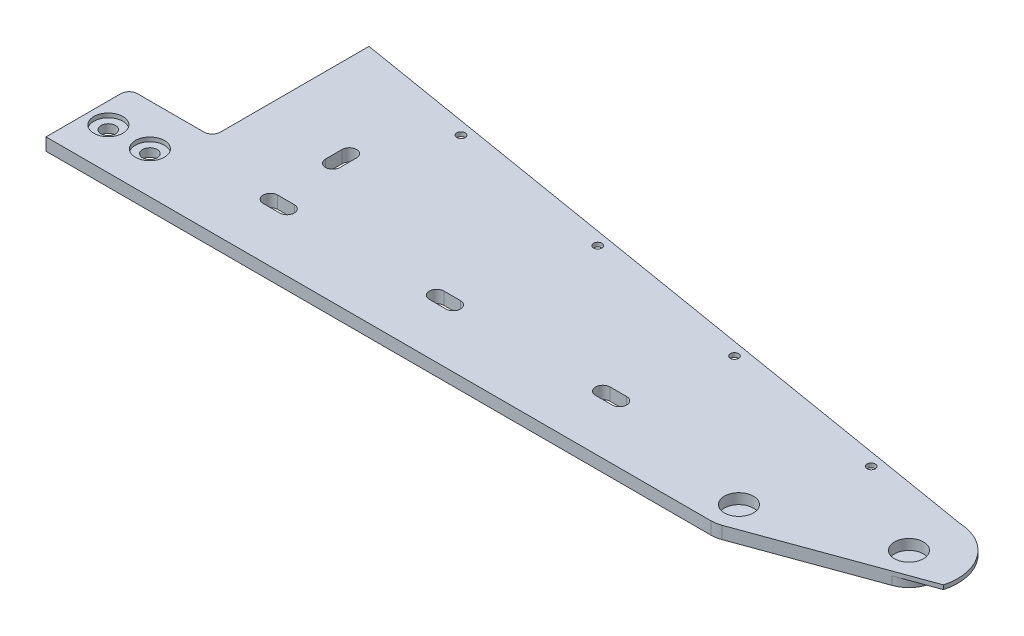
from build123d import *

# Parameters (mm, degrees)
SKETCH_1_W           = 35
SKETCH_1_H           = 55
EXTRUDE_1_DEPTH      = 1
EXTRUDE_2_DEPTH      = 3
SKETCH_3_R           = 5
CUT_EXTRUDE_1_DEPTH  = 169.569903897
SKETCH_4_R           = 4
CUT_EXTRUDE_2_DEPTH  = 2
SKETCH_5_R           = 2
CUT_EXTRUDE_3_DEPTH  = 2
EXTRUDE_START        = 7
EXTRUDE_3_DEPTH      = 7
CUT_EXTRUDE_START    = -1.5
SKETCH_9_W           = 10
SKETCH_9_H           = 26
CUT_EXTRUDE_4_DEPTH  = 168.318874833
SKETCH_10_R          = 1.5
CUT_EXTRUDE_5_DEPTH  = 194.595583627
EXTRUDE_4_DEPTH      = 3
SKETCH_13_W          = 334.012533363
SKETCH_13_H          = 161.456209481
CUT_EXTRUDE_6_DEPTH  = 10
CUT_EXTRUDE_START_2  = -0.5
SKETCH_14_R          = 3.5
CUT_EXTRUDE_7_DEPTH  = 179.354165453
SKETCH_15_R          = 5
CUT_EXTRUDE_8_DEPTH  = 179.854165453
EXTRUDE_START_2      = -3
EXTRUDE_5_DEPTH      = 16
EXTRUDE_7_DEPTH      = 7
SKETCH_24_W          = 10
SKETCH_24_H          = 26
CUT_EXTRUDE_11_DEPTH = 180.209193181
SKETCH_25_R          = 1.5
CUT_EXTRUDE_12_DEPTH = 176.793913433
THREAD_2_PITCH       = 0.6
CUT_EXTRUDE_13_DEPTH = 181.709193232
EXTRUDE_START_3      = 2
SKETCH_27_R          = 5
EXTRUDE_8_DEPTH      = 2
CUT_EXTRUDE_START_3  = -2
SKETCH_28_W          = 25
SKETCH_28_H          = 47.640496167
CUT_EXTRUDE_14_DEPTH = 182.247184378
SKETCH_29_R          = 7.5
CUT_EXTRUDE_15_DEPTH = 4
CUT_EXTRUDE_16_DEPTH = 10
SKETCH_32_R          = 1.896812978
CUT_EXTRUDE_17_DEPTH = 10
CUT_EXTRUDE_START_4  = -19
CUT_EXTRUDE_18_DEPTH = 2
CUT_EXTRUDE_19_DEPTH = 180.762490825
CUT_EXTRUDE_20_DEPTH = 176.782687167
CUT_EXTRUDE_21_DEPTH = 175.343166372
SKETCH_37_R          = 1
CUT_EXTRUDE_22_DEPTH = 175.199743974
EXTRUDE_START_4      = -1
SKETCH_39_R          = 5
EXTRUDE_9_DEPTH      = 1
SKETCH_40_W          = 2.395962652
SKETCH_40_H          = 5.687033247
CUT_EXTRUDE_23_DEPTH = 192.518571686
SKETCH_41_W          = 88.49347393
SKETCH_41_H          = 24.829104196
CUT_EXTRUDE_24_DEPTH = 192.518571686
SKETCH_42_W          = 20
SKETCH_42_H          = 3
EXTRUDE_10_DEPTH     = 20
SKETCH_43_R          = 1.75
CUT_EXTRUDE_25_DEPTH = 20
SKETCH_45_R          = 3.5
CUT_EXTRUDE_26_DEPTH = 1
FILLET_1_R           = 2


with BuildPart() as part:
    # 草图1 → 凸台-拉伸1 (new body)
    with BuildSketch(Plane(origin=(0, 0, 0), x_dir=(1, 0, 0), z_dir=(0, 1, 0))):
        Rectangle(SKETCH_1_W, SKETCH_1_H)
    extrude(amount=EXTRUDE_1_DEPTH)

    # Sketch 2 → 凸台-拉伸2 (add)
    with BuildSketch(Plane(origin=(0, 1, 0), x_dir=(1, 0, 0), z_dir=(0, 1, 0))):
        with BuildLine():
            Line((106.75, -2.25), (106.75, 2.25))
            Line((106.75, 2.25), (121.75, 2.25))
            ThreePointArc((121.75, 2.25), (122.922125199, 2.352547667), (124.058635967, 2.65707481))
            Line((124.058635967, 2.65707481), (154.058635967, 13.576181838))
            ThreePointArc((154.058635967, 13.576181838), (158.397452333, 21.091232227), (151.75, 26.669107028))
            Line((151.75, 26.669107028), (-31.447415548, 57.101298968))
            ThreePointArc((-31.447415548, 57.101298968), (-37.800418235, 56.264673928), (-42.609265279, 52.029632639))
            Line((-42.609265279, 52.029632639), (-60.161792173, 23.605896086))
            ThreePointArc((-60.161792173, 23.605896086), (-61.717833724, 20.073278016), (-62.25, 16.25))
            Line((-62.25, 16.25), (-62.25, -16.25))
            ThreePointArc((-62.25, -16.25), (-61.717833724, -20.073278016), (-60.161792173, -23.605896086))
            Line((-60.161792173, -23.605896086), (-42.609265279, -52.029632639))
            ThreePointArc((-42.609265279, -52.029632639), (-37.800418235, -56.264673928), (-31.447415548, -57.101298968))
            Line((-31.447415548, -57.101298968), (151.75, -26.669107028))
            ThreePointArc((151.75, -26.669107028), (158.397452333, -21.091232227), (154.058635967, -13.576181838))
            Line((154.058635967, -13.576181838), (124.058635967, -2.65707481))
            ThreePointArc((124.058635967, -2.65707481), (122.922125199, -2.352547667), (121.75, -2.25))
            Line((121.75, -2.25), (106.75, -2.25))
        make_face()
    extrude(amount=EXTRUDE_2_DEPTH)

    # 草图3 → 切除-拉伸1 (cut, through all)
    with BuildSketch(Plane(origin=(0, 4, 0), x_dir=(1, 0, 0), z_dir=(0, 1, 0))):
        with Locations(Location((-48.25, 16.25, 0), (0, 0, 270))):
            Circle(SKETCH_3_R)
        with Locations(Location((-48.25, -16.25, 0), (0, 0, 270))):
            Circle(SKETCH_3_R)
    extrude(amount=-CUT_EXTRUDE_1_DEPTH, mode=Mode.SUBTRACT)

    # 草图4 → 切除-拉伸2 (cut)
    with BuildSketch(Plane(origin=(0, 4, 0), x_dir=(1, 0, 0), z_dir=(0, 1, 0))):
        with Locations(Location((-33.25, 46.25, 0), (0, 0, 270))):
            Circle(SKETCH_4_R)
        with Locations(Location((-33.25, -46.25, 0), (0, 0, 270))):
            Circle(SKETCH_4_R)
    extrude(amount=-CUT_EXTRUDE_2_DEPTH, mode=Mode.SUBTRACT)

    # 草图5 → 切除-拉伸3 (cut)
    with BuildSketch(Plane(origin=(0, 4, 0), x_dir=(1, 0, 0), z_dir=(0, 1, 0))):
        with Locations(Location((121.75, 9, 0), (0, 0, 270))):
            Circle(SKETCH_5_R)
        with Locations(Location((121.75, -9, 0), (0, 0, 270))):
            Circle(SKETCH_5_R)
        with Locations(Location((151.75, 19.919107028, 0), (0, 0, 270))):
            Circle(SKETCH_5_R)
        with Locations(Location((151.75, -19.919107028, 0), (0, 0, 270))):
            Circle(SKETCH_5_R)
    extrude(amount=-CUT_EXTRUDE_3_DEPTH, mode=Mode.SUBTRACT)

    # 草图8 → 凸台-拉伸3 (add)
    with BuildSketch(Plane.XZ.offset(-1).offset(EXTRUDE_START)):
        with BuildLine():
            Line((-26.75, -26.25), (-39.75, -26.25))
            Line((-39.75, -26.25), (-39.75, -55.124119675))
            ThreePointArc((-39.75, -55.124119675), (-35.798281322, -56.950759894), (-31.447415548, -57.101298968))
            Line((-31.447415548, -57.101298968), (-26.75, -56.320978726))
            Line((-26.75, -56.320978726), (-26.75, -26.25))
        make_face()
    extrude_3 = extrude(amount=-EXTRUDE_3_DEPTH)

    # 镜向1: 凸台-拉伸3 across plane
    add(extrude_3.mirror(Plane.XY))

    # 草图9 → 切除-拉伸4 (cut, through all)
    with BuildSketch(Plane.XZ.offset(6).offset(CUT_EXTRUDE_START)):
        with Locations((-33.25, -40.75)):
            Rectangle(SKETCH_9_W, SKETCH_9_H)
    cut_extrude_4 = extrude(amount=-CUT_EXTRUDE_4_DEPTH, mode=Mode.SUBTRACT)

    # 镜向2: 切除-拉伸4 across plane
    add(cut_extrude_4.mirror(Plane.XY), mode=Mode.SUBTRACT)

    # 草图10 → 切除-拉伸5 (cut, through all)
    with BuildSketch(Plane.XY.offset(-53.75)):
        with Locations((-33.25, -1.5)):
            Circle(SKETCH_10_R)
    cut_extrude_5 = extrude(amount=-CUT_EXTRUDE_5_DEPTH, mode=Mode.SUBTRACT)

    # 镜向3: 切除-拉伸5 across plane
    add(cut_extrude_5.mirror(Plane.XY), mode=Mode.SUBTRACT)

    # 草图12 → 凸台-拉伸4 (add)
    with BuildSketch(Plane(origin=(0, 4, 0), x_dir=(1, 0, 0), z_dir=(0, 1, 0))):
        with BuildLine():
            Line((152.536154407, 34.648141662), (-30.136445037, 64.993152763))
            ThreePointArc((-30.136445037, 64.993152763), (-32.296727103, 65.226071005), (-34.469475839, 65.210824842))
            Line((-34.469475839, 65.210824842), (-60.161792173, 23.605896086))
            ThreePointArc((-60.161792173, 23.605896086), (-61.717833724, 20.073278016), (-62.25, 16.25))
            Line((-62.25, 16.25), (-62.25, 2.25))
            Line((-62.25, 2.25), (121.75, 2.25))
            ThreePointArc((121.75, 2.25), (122.922125199, 2.352547667), (124.058635967, 2.65707481))
            Line((124.058635967, 2.65707481), (166.382589153, 18.061733966))
            ThreePointArc((166.382589153, 18.061733966), (163.073058037, 29.371665237), (152.536154407, 34.648141662))
        make_face()
    extrude(amount=EXTRUDE_4_DEPTH)

    # 草图13 → 切除-拉伸6 (cut)
    with BuildSketch(Plane.XZ.offset(-4)):
        with Locations((47.836319436, 6.16656882)):
            Rectangle(SKETCH_13_W, SKETCH_13_H)
    extrude(amount=CUT_EXTRUDE_6_DEPTH, mode=Mode.SUBTRACT)

    # 草图14 → 切除-拉伸7 (cut, through all)
    with BuildSketch(Plane.XZ.offset(-4).offset(CUT_EXTRUDE_START_2)):
        with Locations(Location((151.75, -19.919107028, 0), (0, 0, 270))):
            Circle(SKETCH_14_R)
        with Locations(Location((121.75, -9, 0), (0, 0, 270))):
            Circle(SKETCH_14_R)
    extrude(amount=-CUT_EXTRUDE_7_DEPTH, mode=Mode.SUBTRACT)

    # 草图15 → 切除-拉伸8 (cut, through all)
    with BuildSketch(Plane.XZ.offset(-4)):
        with Locations(Location((-48.25, -16.25, 0), (0, 0, 270))):
            Circle(SKETCH_15_R)
    extrude(amount=-CUT_EXTRUDE_8_DEPTH, mode=Mode.SUBTRACT)

    # 草图17 → 凸台-拉伸5 (add)
    with BuildSketch(Plane.XZ.offset(-4).offset(EXTRUDE_START_2)):
        with BuildLine():
            Line((-30.628058978, -62.03370759), (152.218782473, -31.659751942))
            ThreePointArc((152.218782473, -31.659751942), (161.216553887, -26.879484712), (163.096310198, -16.865626245))
            Line((163.096310198, -16.865626245), (166.382589153, -18.061733966))
            ThreePointArc((166.382589153, -18.061733966), (163.073058037, -29.371665237), (152.536154407, -34.648141662))
            Line((152.536154407, -34.648141662), (-30.136445037, -64.993152763))
            ThreePointArc((-30.136445037, -64.993152763), (-32.296727103, -65.226071005), (-34.469475839, -65.210824842))
            Line((-34.469475839, -65.210824842), (-36.504423199, -61.915526791))
            ThreePointArc((-36.504423199, -61.915526791), (-33.571714316, -62.246765295), (-30.628058978, -62.03370759))
        make_face()
    extrude(amount=-EXTRUDE_5_DEPTH)

    # 草图23 → 凸台-拉伸7 (add)
    with BuildSketch(Plane.XZ.offset(-4).offset(EXTRUDE_START)):
        with BuildLine():
            Line((-39.75, -56.65979236), (-39.75, -26.25))
            Line((-39.75, -26.25), (-26.75, -26.25))
            Line((-26.75, -26.25), (-26.75, -64.430606916))
            Line((-26.75, -64.430606916), (-30.136445037, -64.993152763))
            ThreePointArc((-30.136445037, -64.993152763), (-32.296727103, -65.226071005), (-34.469475839, -65.210824842))
            Line((-34.469475839, -65.210824842), (-39.75, -56.65979236))
        make_face()
    extrude(amount=-EXTRUDE_7_DEPTH)

    # 草图24 → 切除-拉伸11 (cut, through all)
    with BuildSketch(Plane.XZ.offset(3).offset(CUT_EXTRUDE_START)):
        with Locations((-33.25, -40.75)):
            Rectangle(SKETCH_24_W, SKETCH_24_H)
    extrude(amount=-CUT_EXTRUDE_11_DEPTH, mode=Mode.SUBTRACT)

    # 草图25 → 切除-拉伸12 (cut, through all)
    with BuildSketch(Plane.XY.offset(-53.75)):
        with Locations((-33.25, 1.5)):
            Circle(SKETCH_25_R)
    extrude(amount=-CUT_EXTRUDE_12_DEPTH, mode=Mode.SUBTRACT)

    # 螺纹线2: the profile of Sketch 2 2 profile screwed along a right-hand helix of 25 turns, 6 arcs to a turn; built about Z, then put on its axis
    thread_2_z = Axis((0, 0, 0), (0, 0, 1))
    thread_2_corners = [(1.4997, 0, -0.000173205), (1.824759525, 0, 0.187499999), (1.824759525, 0, 0.262499999), (1.4997, 0, 0.450173203)]
    with BuildLine(mode=Mode.PRIVATE) as thread_2_profile:
        Line(thread_2_corners[0], thread_2_corners[1])
        Line(thread_2_corners[1], thread_2_corners[2])
        Line(thread_2_corners[2], thread_2_corners[3])
        Line(thread_2_corners[3], thread_2_corners[0])
    thread_2_cap = Face(thread_2_profile.wire())
    thread_2_turn_angles = [0, 30, 60, 90, 120, 150, 180, 210, 240, 270, 300, 330, 360]
    thread_2_turn_weights = [1, 0.8660254037844387, 1, 0.8660254037844387, 1, 0.8660254037844387, 1, 0.8660254037844387, 1, 0.8660254037844387, 1, 0.8660254037844387, 1]
    thread_2_turn_rails = [Edge.make_bspline([Vector(p[0], p[1], 0).rotate(thread_2_z, thread_2_turn_angles[k]) / thread_2_turn_weights[k] + Vector(0, 0, p[2] + THREAD_2_PITCH * thread_2_turn_angles[k] / 360) for k in range(13)], [0, 0, 0, 1, 1, 2, 2, 3, 3, 4, 4, 5, 5, 6, 6, 6], 2, thread_2_turn_weights) for p in thread_2_corners]
    thread_2_turn_sides = [Face.make_surface_from_curves(thread_2_turn_rails[p[0]], thread_2_turn_rails[p[1]]) for p in [(0, 1), (1, 2), (2, 3), (3, 0)]]
    thread_2 = Plane(origin=(-33.25, 1.5, -53.75), x_dir=(-1, 0, 0), z_dir=(0, 0, -1)) * Solid(Shell([*[p.moved(Location((0, 0, THREAD_2_PITCH * i))) for i in range(25) for p in thread_2_turn_sides], thread_2_cap, thread_2_cap.rotate(thread_2_z, 9000).moved(Location((0, 0, THREAD_2_PITCH * 9000 / 360)))]))
    add(thread_2, mode=Mode.SUBTRACT)

    # 草图26 → 切除-拉伸13 (cut, through all)
    with BuildSketch(Plane.XZ.offset(3)):
        with BuildLine():
            Line((-26.75, -64.430606916), (-26.75, -26.25))
            Line((-26.75, -26.25), (-39.75, -26.25))
            Line((-39.75, -26.25), (-39.75, -56.65979236))
            Line((-39.75, -56.65979236), (-34.469475839, -65.210824842))
            ThreePointArc((-34.469475839, -65.210824842), (-32.296727103, -65.226071005), (-30.136445037, -64.993152763))
            Line((-30.136445037, -64.993152763), (-26.75, -64.430606916))
        make_face()
    extrude(amount=-CUT_EXTRUDE_13_DEPTH, mode=Mode.SUBTRACT)

    # 草图27 → 凸台-拉伸8 (add)
    with BuildSketch(Plane.XZ.offset(-4).offset(EXTRUDE_START_3)):
        with BuildLine():
            Line((-39.75, -56.65979236), (-39.75, -26.25))
            Line((-39.75, -26.25), (-26.75, -26.25))
            Line((-26.75, -26.25), (-26.75, -64.430606916))
            Line((-26.75, -64.430606916), (-18.25, -63.018613025))
            Line((-18.25, -63.018613025), (-18.25, -2.25))
            Line((-18.25, -2.25), (-62.25, -2.25))
            Line((-62.25, -2.25), (-62.25, -16.25))
            ThreePointArc((-62.25, -16.25), (-61.717833724, -20.073278016), (-60.161792173, -23.605896086))
            Line((-60.161792173, -23.605896086), (-39.75, -56.65979236))
        make_face()
        with Locations(Location((-48.25, -16.25, 0), (0, 0, 270))):
            Circle(SKETCH_27_R, mode=Mode.SUBTRACT)
    extrude(amount=-EXTRUDE_8_DEPTH)

    # 草图28 → 切除-拉伸14 (cut, through all)
    with BuildSketch(Plane(origin=(0, 7, 0), x_dir=(1, 0, 0), z_dir=(0, 1, 0)).offset(CUT_EXTRUDE_START_3)):
        with Locations((-33.25, 50.070248084)):
            Rectangle(SKETCH_28_W, SKETCH_28_H)
    extrude(amount=CUT_EXTRUDE_14_DEPTH, mode=Mode.SUBTRACT)

    # 草图29 → 切除-拉伸15 (cut)
    with BuildSketch(Plane(origin=(0, 7, 0), x_dir=(1, 0, 0), z_dir=(0, 1, 0))):
        with Locations(Location((-48.25, 16.25, 0), (0, 0, 270))):
            Circle(SKETCH_29_R)
    extrude(amount=-CUT_EXTRUDE_15_DEPTH, mode=Mode.SUBTRACT)

    # 草图31 → 切除-拉伸16 (cut)
    with BuildSketch(Plane.XZ.offset(-4)):
        with BuildLine():
            Line((7.5, -16.25), (0, -16.25))
            ThreePointArc((0, -16.25), (0.512563133, -17.487436867), (1.75, -18))
            Line((1.75, -18), (5.75, -18))
            ThreePointArc((5.75, -18), (6.987436867, -17.487436867), (7.5, -16.25))
        make_face()
        with BuildLine():
            ThreePointArc((1.75, -14.5), (0.512563133, -15.012563133), (0, -16.25))
            Line((0, -16.25), (7.5, -16.25))
            ThreePointArc((7.5, -16.25), (6.987436867, -15.012563133), (5.75, -14.5))
            Line((5.75, -14.5), (1.75, -14.5))
        make_face()
        with BuildLine():
            Line((47.5, -16.25), (40, -16.25))
            ThreePointArc((40, -16.25), (40.512563133, -17.487436867), (41.75, -18))
            Line((41.75, -18), (45.75, -18))
            ThreePointArc((45.75, -18), (46.987436867, -17.487436867), (47.5, -16.25))
        make_face()
        with BuildLine():
            ThreePointArc((41.75, -14.5), (40.512563133, -15.012563133), (40, -16.25))
            Line((40, -16.25), (47.5, -16.25))
            ThreePointArc((47.5, -16.25), (46.987436867, -15.012563133), (45.75, -14.5))
            Line((45.75, -14.5), (41.75, -14.5))
        make_face()
        with BuildLine():
            ThreePointArc((81.75, -14.5), (80.512563133, -15.012563133), (80, -16.25))
            Line((80, -16.25), (87.5, -16.25))
            ThreePointArc((87.5, -16.25), (86.987436867, -15.012563133), (85.75, -14.5))
            Line((85.75, -14.5), (81.75, -14.5))
        make_face()
        with BuildLine():
            Line((87.5, -16.25), (80, -16.25))
            ThreePointArc((80, -16.25), (80.512563133, -17.487436867), (81.75, -18))
            Line((81.75, -18), (85.75, -18))
            ThreePointArc((85.75, -18), (86.987436867, -17.487436867), (87.5, -16.25))
        make_face()
        with BuildLine():
            Line((0, -31.25), (0, -35.25))
            ThreePointArc((0, -35.25), (1.75, -37), (3.5, -35.25))
            Line((3.5, -35.25), (3.5, -31.25))
            ThreePointArc((3.5, -31.25), (1.75, -29.5), (0, -31.25))
        make_face()
    extrude(amount=-CUT_EXTRUDE_16_DEPTH, mode=Mode.SUBTRACT)

    # 草图32 → 切除-拉伸17 (cut)
    with BuildSketch(Plane(origin=(0, 5, 0), x_dir=(1, 0, 0), z_dir=(0, 1, 0))):
        with Locations(Location((-42.75, 41.25, 0), (0, 0, 270))):
            Circle(SKETCH_32_R)
        with Locations(Location((-42.75, 31.25, 0), (0, 0, 270))):
            Circle(SKETCH_32_R)
        with Locations(Location((-23.607466011, 41.25, 0), (0, 0, 270))):
            Circle(SKETCH_32_R)
        with Locations(Location((-23.607466011, 31.25, 0), (0, 0, 270))):
            Circle(SKETCH_32_R)
    extrude(amount=-CUT_EXTRUDE_17_DEPTH, mode=Mode.SUBTRACT)

    # 草图33 → 切除-拉伸18 (cut)
    with BuildSketch(Plane(origin=(0, 23, 0), x_dir=(1, 0, 0), z_dir=(0, 1, 0)).offset(CUT_EXTRUDE_START_4)):
        with BuildLine():
            Line((-26.75, 56.320978726), (151.75, 26.669107028))
            ThreePointArc((151.75, 26.669107028), (158.397452333, 21.091232227), (154.058635967, 13.576181838))
            Line((154.058635967, 13.576181838), (163.096310198, 16.865626245))
            Line((163.096310198, 16.865626245), (166.382589153, 18.061733966))
            ThreePointArc((166.382589153, 18.061733966), (163.073058037, 29.371665237), (152.536154407, 34.648141662))
            Line((152.536154407, 34.648141662), (-20.75, 63.433905346))
            Line((-20.75, 63.433905346), (-26.75, 64.430606916))
            Line((-26.75, 64.430606916), (-26.75, 56.320978726))
        make_face()
    extrude(amount=CUT_EXTRUDE_18_DEPTH, mode=Mode.SUBTRACT)

    # 草图34 → 切除-拉伸19 (cut, through all)
    with BuildSketch(Plane(origin=(0, 23, 0), x_dir=(1, 0, 0), z_dir=(0, 1, 0))):
        with BuildLine():
            Line((152.536154407, 34.648141662), (-20.75, 63.433905346))
            Line((-20.75, 63.433905346), (-20.75, 60.392794775))
            Line((-20.75, 60.392794775), (152.218782473, 31.659751942))
            ThreePointArc((152.218782473, 31.659751942), (161.216553887, 26.879484712), (163.096310198, 16.865626245))
            Line((163.096310198, 16.865626245), (166.382589153, 18.061733966))
            ThreePointArc((166.382589153, 18.061733966), (163.073058037, 29.371665237), (152.536154407, 34.648141662))
        make_face()
    extrude(amount=-CUT_EXTRUDE_19_DEPTH, mode=Mode.SUBTRACT)

    # 草图35 → 切除-拉伸20 (cut, through all)
    with BuildSketch(Plane.XZ.offset(-6)):
        Polygon((-20.75, -60.392794775), (-20.75, -55.324277157), (-34.501982631, -57.608714269), (-32.134133376, -71.862825995), (-8.577554705, -67.949679505), (-10.126047391, -58.627976401), align=None)
        Polygon((-10.94540396, -53.695567779), (-20.75, -55.324277157), (-20.75, -60.392794775), (-10.126047391, -58.627976401), align=None)
    extrude(amount=CUT_EXTRUDE_20_DEPTH, mode=Mode.SUBTRACT)

    # 草图36 → 切除-拉伸21 (cut, through all)
    with BuildSketch(Plane.XZ.offset(-6)):
        Polygon((-18.25, -54.908984836), (-18.25, -59.977502454), (-20.75, -60.392794775), (-20.75, -55.324277157), align=None)
    extrude(amount=-CUT_EXTRUDE_21_DEPTH, mode=Mode.SUBTRACT)

    # 草图37 → 切除-拉伸22 (cut, through all)
    with BuildSketch(Plane.XZ.offset(-6)):
        with BuildLine():
            ThreePointArc((12.330933455, -52.363232915), (11.180580417, -51.540622505), (10.357970006, -52.690975543))
            Line((10.357970006, -52.690975543), (12.330933455, -52.363232915))
        make_face()
        with BuildLine():
            Line((12.330933455, -52.363232915), (10.357970006, -52.690975543))
            ThreePointArc((10.357970006, -52.690975543), (11.426665707, -53.52371893), (12.344451731, -52.527104229))
            ThreePointArc((12.344451731, -52.527104229), (12.341066432, -52.444890254), (12.330933455, -52.363232915))
        make_face()
        with BuildLine():
            ThreePointArc((130.708740378, -32.698675253), (129.55838734, -31.876064842), (128.73577693, -33.02641788))
            Line((128.73577693, -33.02641788), (130.708740378, -32.698675253))
        make_face()
        with BuildLine():
            Line((130.708740378, -32.698675253), (128.73577693, -33.02641788))
            ThreePointArc((128.73577693, -33.02641788), (129.80447263, -33.859161267), (130.722258654, -32.862546567))
            ThreePointArc((130.722258654, -32.862546567), (130.718873355, -32.780332591), (130.708740378, -32.698675253))
        make_face()
        with Locations(Location((50.803720705, -45.972251675, 0), (0, 0, 270))):
            Circle(SKETCH_37_R)
        with Locations(Location((90.26298968, -39.417399121, 0), (0, 0, 270))):
            Circle(SKETCH_37_R)
    extrude(amount=-CUT_EXTRUDE_22_DEPTH, mode=Mode.SUBTRACT)

    # 草图39 → 凸台-拉伸9 (add)
    with BuildSketch(Plane(origin=(0, 3, 0), x_dir=(1, 0, 0), z_dir=(0, 1, 0)).offset(EXTRUDE_START_4)):
        with Locations((-48.25, 16.25)):
            Circle(SKETCH_39_R)
    extrude(amount=EXTRUDE_9_DEPTH)

    # 草图40 → 切除-拉伸23 (cut, through all)
    with BuildSketch(Plane.ZY.offset(18.25)):
        with Locations((-56.106966162, 4.156483376)):
            Rectangle(SKETCH_40_W, SKETCH_40_H)
    extrude(amount=CUT_EXTRUDE_23_DEPTH, mode=Mode.SUBTRACT)

    # 草图41 → 切除-拉伸24 (cut, through all)
    with BuildSketch(Plane(origin=(-18.25, 0, 0), x_dir=(0, 0, -1), z_dir=(1, 0, 0))):
        with Locations((34.742620302, 5.018629916)):
            Rectangle(SKETCH_41_W, SKETCH_41_H)
    extrude(amount=-CUT_EXTRUDE_24_DEPTH, mode=Mode.SUBTRACT)

    # 草图42 → 凸台-拉伸10 (add)
    with BuildSketch(Plane.ZY.offset(18.25)):
        with Locations((-12.25, 5.5)):
            Rectangle(SKETCH_42_W, SKETCH_42_H)
    extrude(amount=EXTRUDE_10_DEPTH)

    # 草图43 → 切除-拉伸25 (cut)
    with BuildSketch(Plane.XZ.offset(-4)):
        with Locations(Location((-33.25, -12.25, 0), (0, 0, 270))):
            Circle(SKETCH_43_R)
        with Locations(Location((-23.25, -12.25, 0), (0, 0, 270))):
            Circle(SKETCH_43_R)
    extrude(amount=-CUT_EXTRUDE_25_DEPTH, mode=Mode.SUBTRACT)

    # 草图45 → 切除-拉伸26 (cut)
    with BuildSketch(Plane(origin=(0, 7, 0), x_dir=(1, 0, 0), z_dir=(0, 1, 0))):
        with Locations(Location((-33.25, 12.25, 0), (0, 0, 270))):
            Circle(SKETCH_45_R)
        with Locations(Location((-23.25, 12.25, 0), (0, 0, 270))):
            Circle(SKETCH_45_R)
    extrude(amount=-CUT_EXTRUDE_26_DEPTH, mode=Mode.SUBTRACT)

    # 圆角1
    fillet_1_edges = [part.edges().sort_by_distance(p)[0] for p in [
        (-18.25, 5.5, -22.25),
        (-38.25, 5.5, -22.25),
    ]]
    fillet(fillet_1_edges, radius=FILLET_1_R)


solid = part.part
